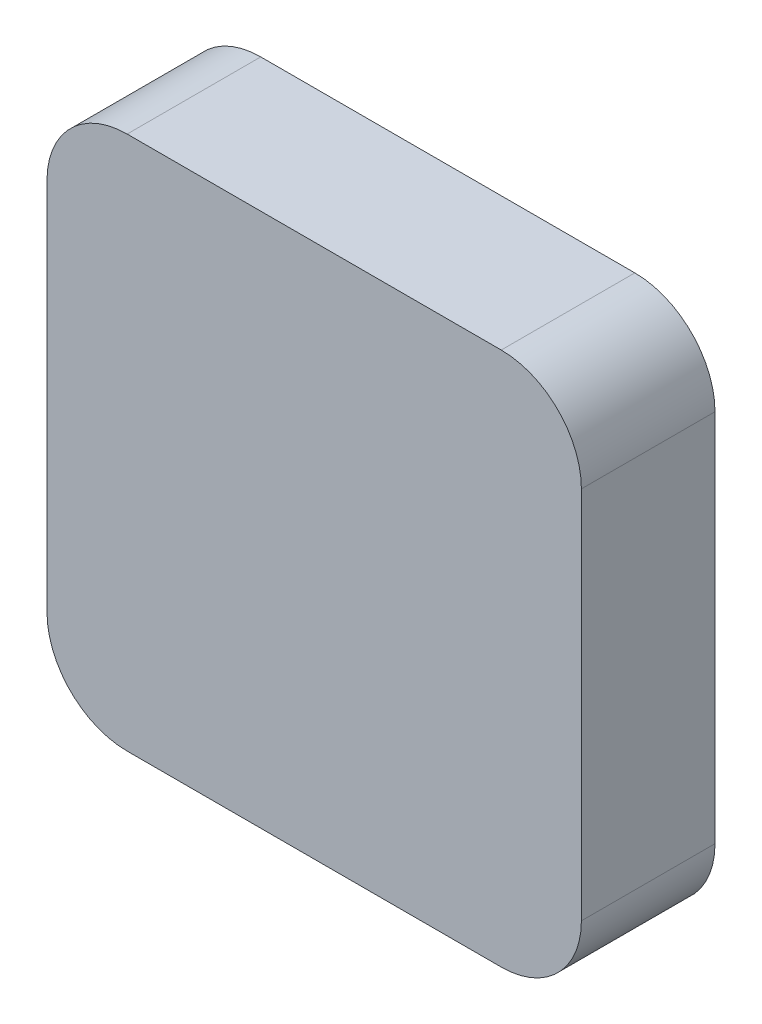
from build123d import *

# Parameters (mm, degrees)
SKETCH1_W           = 20
SKETCH1_H           = 20
BOSS_EXTRUDE1_DEPTH = 2.5
FILLET1_R           = 3


with BuildPart() as part:
    # Sketch1 → Boss-Extrude1 (new, symmetric)
    with BuildSketch(Plane.XY):
        Rectangle(SKETCH1_W, SKETCH1_H)
    extrude(amount=BOSS_EXTRUDE1_DEPTH, both=True)

    # Fillet1
    fillet1_edges = [part.edges().sort_by_distance(p)[0] for p in [
        (-10, -10, 0),
        (10, -10, 0),
        (-10, 10, 0),
        (10, 10, 0),
    ]]
    fillet(fillet1_edges, radius=FILLET1_R)


solid = part.part
